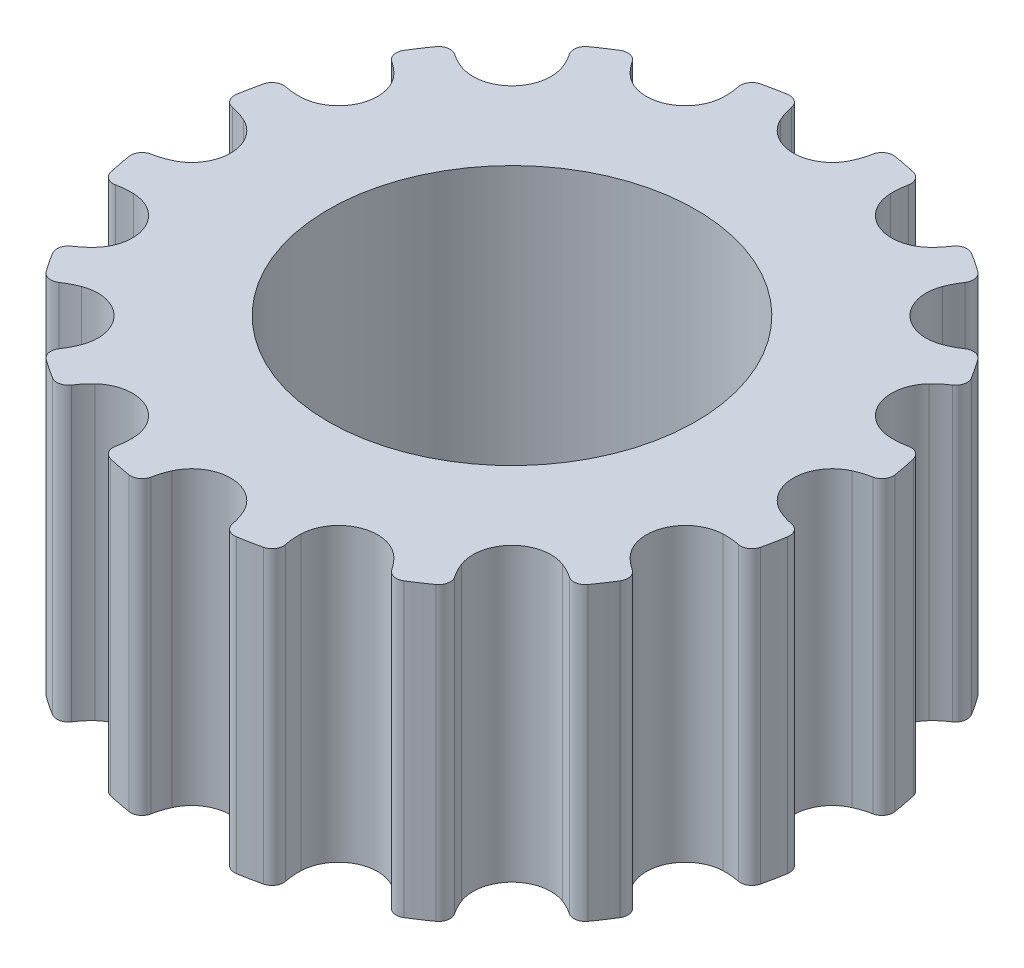
from build123d import *

# Parameters (mm, degrees)
SKETCH1_R           = 4
BOSS_EXTRUDE1_DEPTH = 3.175


with BuildPart() as part:
    # Sketch1 → Boss-Extrude1 (new, symmetric)
    with BuildSketch(Plane(origin=(0, 0, 0), x_dir=(1, 0, 0), z_dir=(0, 1, 0))):
        with BuildLine():
            ThreePointArc((-1.850768, -6.777037356), (-1.816941892, -6.962421006), (-1.663291889, -7.071521784))
            ThreePointArc((-1.663291889, -7.071521784), (-1.417233644, -7.124914669), (-1.169472895, -7.169748489))
            ThreePointArc((-1.169472895, -7.169748489), (-0.985767742, -7.127751824), (-0.883573242, -6.969424355))
            ThreePointArc((-0.883573242, -6.969424355), (-0.839120956, -6.792881518), (-0.773880597, -6.622919538))
            ThreePointArc((-0.773880597, -6.622919538), (0, -6.1245), (0.773880597, -6.622919538))
            ThreePointArc((0.773880597, -6.622919538), (0.839120956, -6.792881518), (0.883573242, -6.969424355))
            ThreePointArc((0.883573242, -6.969424355), (0.985767742, -7.127751824), (1.169472895, -7.169748489))
            ThreePointArc((1.169472895, -7.169748489), (1.417233644, -7.124914669), (1.663291889, -7.071521784))
            ThreePointArc((1.663291889, -7.071521784), (1.816941892, -6.962421006), (1.850768, -6.777037356))
            ThreePointArc((1.850768, -6.777037356), (1.824276538, -6.596921889), (1.819509137, -6.414931089))
            ThreePointArc((1.819509137, -6.414931089), (2.343744682, -5.658300197), (3.249454025, -5.822628523))
            ThreePointArc((3.249454025, -5.822628523), (3.374769892, -5.954686513), (3.483398468, -6.100779674))
            ThreePointArc((3.483398468, -6.100779674), (3.638403174, -6.20794704), (3.824196033, -6.176445981))
            ThreePointArc((3.824196033, -6.176445981), (4.035939958, -6.040210999), (4.242835561, -5.896719991))
            ThreePointArc((4.242835561, -5.896719991), (4.343038594, -5.737124705), (4.303346591, -5.552907854))
            ThreePointArc((4.303346591, -5.552907854), (4.209944466, -5.396640704), (4.135895098, -5.230327534))
            ThreePointArc((4.135895098, -5.230327534), (4.330675481, -4.330675481), (5.230327534, -4.135895098))
            ThreePointArc((5.230327534, -4.135895098), (5.396640704, -4.209944466), (5.552907854, -4.303346591))
            ThreePointArc((5.552907854, -4.303346591), (5.737124705, -4.343038594), (5.896719991, -4.242835561))
            ThreePointArc((5.896719991, -4.242835561), (6.040210999, -4.035939958), (6.176445981, -3.824196033))
            ThreePointArc((6.176445981, -3.824196033), (6.20794704, -3.638403174), (6.100779674, -3.483398468))
            ThreePointArc((6.100779674, -3.483398468), (5.954686513, -3.374769892), (5.822628523, -3.249454025))
            ThreePointArc((5.822628523, -3.249454025), (5.658300197, -2.343744682), (6.414931089, -1.819509137))
            ThreePointArc((6.414931089, -1.819509137), (6.596921889, -1.824276538), (6.777037356, -1.850768))
            ThreePointArc((6.777037356, -1.850768), (6.962421006, -1.816941892), (7.071521784, -1.663291889))
            ThreePointArc((7.071521784, -1.663291889), (7.124914669, -1.417233644), (7.169748489, -1.169472895))
            ThreePointArc((7.169748489, -1.169472895), (7.127751824, -0.985767742), (6.969424355, -0.883573242))
            ThreePointArc((6.969424355, -0.883573242), (6.792881518, -0.839120956), (6.622919538, -0.773880597))
            ThreePointArc((6.622919538, -0.773880597), (6.1245, 0), (6.622919538, 0.773880597))
            ThreePointArc((6.622919538, 0.773880597), (6.792881518, 0.839120956), (6.969424355, 0.883573242))
            ThreePointArc((6.969424355, 0.883573242), (7.127751824, 0.985767742), (7.169748489, 1.169472895))
            ThreePointArc((7.169748489, 1.169472895), (7.124914669, 1.417233644), (7.071521784, 1.663291889))
            ThreePointArc((7.071521784, 1.663291889), (6.962421006, 1.816941892), (6.777037356, 1.850768))
            ThreePointArc((6.777037356, 1.850768), (6.596921889, 1.824276538), (6.414931089, 1.819509137))
            ThreePointArc((6.414931089, 1.819509137), (5.658300197, 2.343744682), (5.822628523, 3.249454025))
            ThreePointArc((5.822628523, 3.249454025), (5.954686513, 3.374769892), (6.100779674, 3.483398468))
            ThreePointArc((6.100779674, 3.483398468), (6.20794704, 3.638403174), (6.176445981, 3.824196033))
            ThreePointArc((6.176445981, 3.824196033), (6.040210999, 4.035939958), (5.896719991, 4.242835561))
            ThreePointArc((5.896719991, 4.242835561), (5.737124705, 4.343038594), (5.552907854, 4.303346591))
            ThreePointArc((5.552907854, 4.303346591), (5.396640704, 4.209944466), (5.230327534, 4.135895098))
            ThreePointArc((5.230327534, 4.135895098), (4.330675481, 4.330675481), (4.135895098, 5.230327534))
            ThreePointArc((4.135895098, 5.230327534), (4.209944466, 5.396640704), (4.303346591, 5.552907854))
            ThreePointArc((4.303346591, 5.552907854), (4.343038594, 5.737124705), (4.242835561, 5.896719991))
            ThreePointArc((4.242835561, 5.896719991), (4.035939958, 6.040210999), (3.824196033, 6.176445981))
            ThreePointArc((3.824196033, 6.176445981), (3.638403174, 6.20794704), (3.483398468, 6.100779674))
            ThreePointArc((3.483398468, 6.100779674), (3.374769892, 5.954686513), (3.249454025, 5.822628523))
            ThreePointArc((3.249454025, 5.822628523), (2.343744682, 5.658300197), (1.819509137, 6.414931089))
            ThreePointArc((1.819509137, 6.414931089), (1.824276538, 6.596921889), (1.850768, 6.777037356))
            ThreePointArc((1.850768, 6.777037356), (1.816941892, 6.962421006), (1.663291889, 7.071521784))
            ThreePointArc((1.663291889, 7.071521784), (1.417233644, 7.124914669), (1.169472895, 7.169748489))
            ThreePointArc((1.169472895, 7.169748489), (0.985767742, 7.127751824), (0.883573242, 6.969424355))
            ThreePointArc((0.883573242, 6.969424355), (0.839120956, 6.792881518), (0.773880597, 6.622919538))
            ThreePointArc((0.773880597, 6.622919538), (0, 6.1245), (-0.773880597, 6.622919538))
            ThreePointArc((-0.773880597, 6.622919538), (-0.839120956, 6.792881518), (-0.883573242, 6.969424355))
            ThreePointArc((-0.883573242, 6.969424355), (-0.985767742, 7.127751824), (-1.169472895, 7.169748489))
            ThreePointArc((-1.169472895, 7.169748489), (-1.417233644, 7.124914669), (-1.663291889, 7.071521784))
            ThreePointArc((-1.663291889, 7.071521784), (-1.816941892, 6.962421006), (-1.850768, 6.777037356))
            ThreePointArc((-1.850768, 6.777037356), (-1.824276538, 6.596921889), (-1.819509137, 6.414931089))
            ThreePointArc((-1.819509137, 6.414931089), (-2.343744682, 5.658300197), (-3.249454025, 5.822628523))
            ThreePointArc((-3.249454025, 5.822628523), (-3.374769892, 5.954686513), (-3.483398468, 6.100779674))
            ThreePointArc((-3.483398468, 6.100779674), (-3.638403174, 6.20794704), (-3.824196033, 6.176445981))
            ThreePointArc((-3.824196033, 6.176445981), (-4.035939958, 6.040210999), (-4.242835561, 5.896719991))
            ThreePointArc((-4.242835561, 5.896719991), (-4.343038594, 5.737124705), (-4.303346591, 5.552907854))
            ThreePointArc((-4.303346591, 5.552907854), (-4.209944466, 5.396640704), (-4.135895098, 5.230327534))
            ThreePointArc((-4.135895098, 5.230327534), (-4.330675481, 4.330675481), (-5.230327534, 4.135895098))
            ThreePointArc((-5.230327534, 4.135895098), (-5.396640704, 4.209944466), (-5.552907854, 4.303346591))
            ThreePointArc((-5.552907854, 4.303346591), (-5.737124705, 4.343038594), (-5.896719991, 4.242835561))
            ThreePointArc((-5.896719991, 4.242835561), (-6.040210999, 4.035939958), (-6.176445981, 3.824196033))
            ThreePointArc((-6.176445981, 3.824196033), (-6.20794704, 3.638403174), (-6.100779674, 3.483398468))
            ThreePointArc((-6.100779674, 3.483398468), (-5.954686513, 3.374769892), (-5.822628523, 3.249454025))
            ThreePointArc((-5.822628523, 3.249454025), (-5.658300197, 2.343744682), (-6.414931089, 1.819509137))
            ThreePointArc((-6.414931089, 1.819509137), (-6.596921889, 1.824276538), (-6.777037356, 1.850768))
            ThreePointArc((-6.777037356, 1.850768), (-6.962421006, 1.816941892), (-7.071521784, 1.663291889))
            ThreePointArc((-7.071521784, 1.663291889), (-7.124914669, 1.417233644), (-7.169748489, 1.169472895))
            ThreePointArc((-7.169748489, 1.169472895), (-7.127751824, 0.985767742), (-6.969424355, 0.883573242))
            ThreePointArc((-6.969424355, 0.883573242), (-6.792881518, 0.839120956), (-6.622919538, 0.773880597))
            ThreePointArc((-6.622919538, 0.773880597), (-6.1245, 0), (-6.622919538, -0.773880597))
            ThreePointArc((-6.622919538, -0.773880597), (-6.792881518, -0.839120956), (-6.969424355, -0.883573242))
            ThreePointArc((-6.969424355, -0.883573242), (-7.127751824, -0.985767742), (-7.169748489, -1.169472895))
            ThreePointArc((-7.169748489, -1.169472895), (-7.124914669, -1.417233644), (-7.071521784, -1.663291889))
            ThreePointArc((-7.071521784, -1.663291889), (-6.962421006, -1.816941892), (-6.777037356, -1.850768))
            ThreePointArc((-6.777037356, -1.850768), (-6.596921889, -1.824276538), (-6.414931089, -1.819509137))
            ThreePointArc((-6.414931089, -1.819509137), (-5.658300197, -2.343744682), (-5.822628523, -3.249454025))
            ThreePointArc((-5.822628523, -3.249454025), (-5.954686513, -3.374769892), (-6.100779674, -3.483398468))
            ThreePointArc((-6.100779674, -3.483398468), (-6.20794704, -3.638403174), (-6.176445981, -3.824196033))
            ThreePointArc((-6.176445981, -3.824196033), (-6.040210999, -4.035939958), (-5.896719991, -4.242835561))
            ThreePointArc((-5.896719991, -4.242835561), (-5.737124705, -4.343038594), (-5.552907854, -4.303346591))
            ThreePointArc((-5.552907854, -4.303346591), (-5.396640704, -4.209944466), (-5.230327534, -4.135895098))
            ThreePointArc((-5.230327534, -4.135895098), (-4.330675481, -4.330675481), (-4.135895098, -5.230327534))
            ThreePointArc((-4.135895098, -5.230327534), (-4.209944466, -5.396640704), (-4.303346591, -5.552907854))
            ThreePointArc((-4.303346591, -5.552907854), (-4.343038594, -5.737124705), (-4.242835561, -5.896719991))
            ThreePointArc((-4.242835561, -5.896719991), (-4.035939958, -6.040210999), (-3.824196033, -6.176445981))
            ThreePointArc((-3.824196033, -6.176445981), (-3.638403174, -6.20794704), (-3.483398468, -6.100779674))
            ThreePointArc((-3.483398468, -6.100779674), (-3.374769892, -5.954686513), (-3.249454025, -5.822628523))
            ThreePointArc((-3.249454025, -5.822628523), (-2.343744682, -5.658300197), (-1.819509137, -6.414931089))
            ThreePointArc((-1.819509137, -6.414931089), (-1.824276538, -6.596921889), (-1.850768, -6.777037356))
        make_face()
        Circle(SKETCH1_R, mode=Mode.SUBTRACT)
    extrude(amount=BOSS_EXTRUDE1_DEPTH, both=True)


solid = part.part
